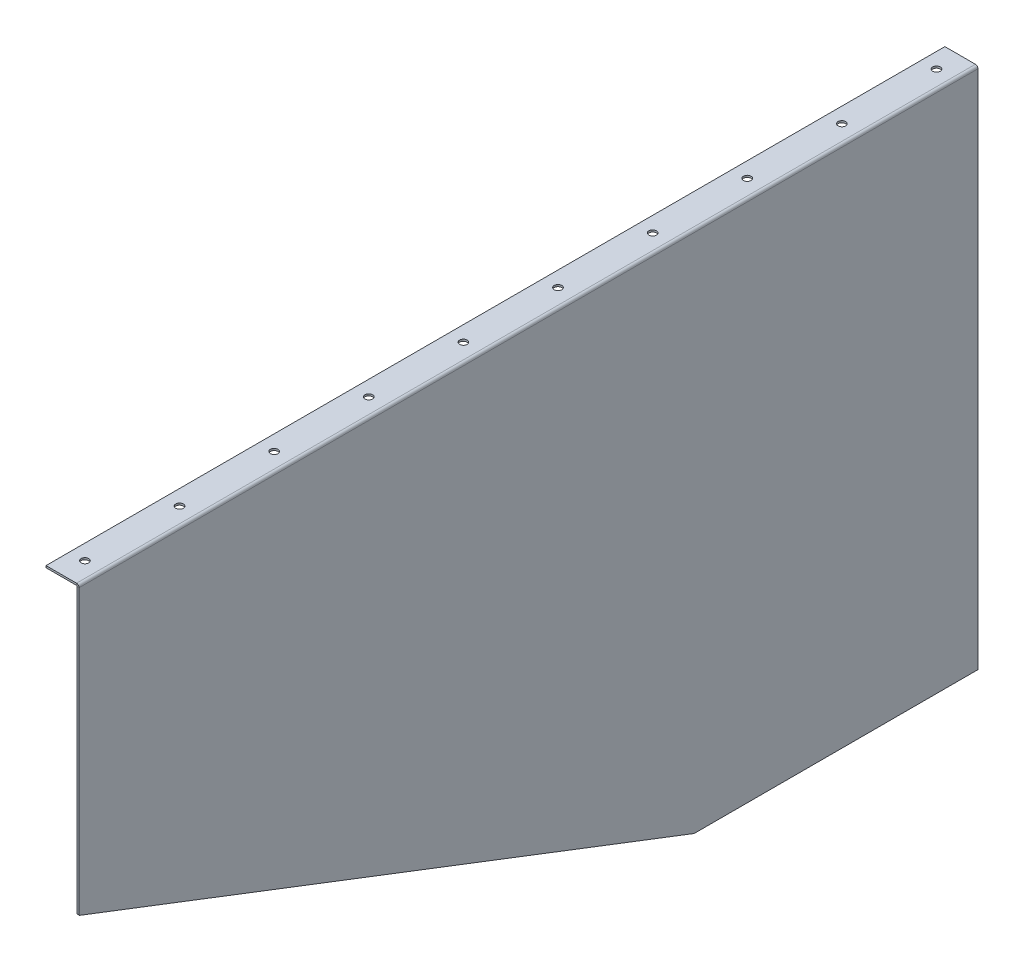
from build123d import *

# Parameters (mm, degrees)
BASE_FLANGE1_DEPTH     = 2
TAB1_START             = -2
TAB1_OUTLINE_W         = 950
TAB1_OUTLINE_H         = 35
TAB1_DEPTH             = 2
SKETCHED_START         = -950
SKETCHED_BEND1_DEPTH   = 950
SKETCHED_BEND1_2_DEPTH = 950
FILLET1_R              = 0.78
FILLET2_R              = 0.74
SKETCH10_R             = 4
CUT_EXTRUDE1_DEPTH     = 10


# Read off the part's stored shape, not the designer's step: Tab1, Sketched Bend1
# Sheet-metal steps are written as plain solids
with BuildPart() as part:
    # Sketch1 → Base-Flange1 (new body)
    with BuildSketch(Plane(origin=(0, 0, 0), x_dir=(0, 0, -1), z_dir=(1, 0, 0))):
        Polygon((0, 0), (0, -300), (650, -550), (950, -550), (950, 0), align=None)
    extrude(amount=-BASE_FLANGE1_DEPTH)

    # Tab1 outline → Tab1 (add)
    with BuildSketch(Plane(origin=(0, 0, 0), x_dir=(0, 0, -1), z_dir=(1, 0, 0)).offset(TAB1_START)):
        with Locations((475, 17.5)):
            Rectangle(TAB1_OUTLINE_W, TAB1_OUTLINE_H)
    extrude(amount=TAB1_DEPTH)

    # Sketched Bend1 outline → Sketched Bend1 (cut)
    with BuildSketch(Plane.XY.offset(SKETCHED_START)):
        with BuildLine():
            Line((-2, 35), (-2, 2.635602398))
            ThreePointArc((-2, 2.635602398), (-0.556604688, 1.654267209), (0, 0))
            Line((0, 0), (0, 35))
            Line((0, 35), (-2, 35))
        make_face()
    extrude(amount=SKETCHED_BEND1_DEPTH, mode=Mode.SUBTRACT)

    # Sketched Bend1 2 outline → Sketched Bend1 2 (add)
    with BuildSketch(Plane.XY.offset(SKETCHED_START)):
        with BuildLine():
            Line((-35.008755099, 0.7366), (-2.7366, 0.7366))
            ThreePointArc((-2.7366, 0.7366), (-2.215745145, 0.520854855), (-2, 0))
            Line((-2, 0), (-2, 2.635602398))
            ThreePointArc((-2, 2.635602398), (-2.364854094, 2.711233029), (-2.7366, 2.7366))
            Line((-2.7366, 2.7366), (-35.008755099, 2.7366))
            Line((-35.008755099, 2.7366), (-35.008755099, 0.7366))
        make_face()
    extrude(amount=SKETCHED_BEND1_2_DEPTH)

    # Fillet1
    fillet1_edges = [part.edges().sort_by_distance(p)[0] for p in [
        (-1, -300, 0),
    ]]
    fillet(fillet1_edges, radius=FILLET1_R)

    # Fillet2
    fillet2_edges = [part.edges().sort_by_distance(p)[0] for p in [
        (-1, -550, -650),
    ]]
    fillet(fillet2_edges, radius=FILLET2_R)

    # Sketch10 → Cut-Extrude1 (cut)
    with BuildSketch(Plane.XZ.offset(-0.7366)):
        with Locations((-18.872677549, -25)):
            Circle(SKETCH10_R)
        with Locations((-18.872677549, -125)):
            Circle(SKETCH10_R)
        with Locations((-18.872677549, -225)):
            Circle(SKETCH10_R)
        with Locations((-18.872677549, -325)):
            Circle(SKETCH10_R)
        with Locations((-18.872677549, -425)):
            Circle(SKETCH10_R)
        with Locations((-18.872677549, -525)):
            Circle(SKETCH10_R)
        with Locations((-18.872677549, -625)):
            Circle(SKETCH10_R)
        with Locations((-18.872677549, -725)):
            Circle(SKETCH10_R)
        with Locations((-18.872677549, -825)):
            Circle(SKETCH10_R)
        with Locations((-18.872677549, -925)):
            Circle(SKETCH10_R)
    extrude(amount=-CUT_EXTRUDE1_DEPTH, mode=Mode.SUBTRACT)


solid = part.part
